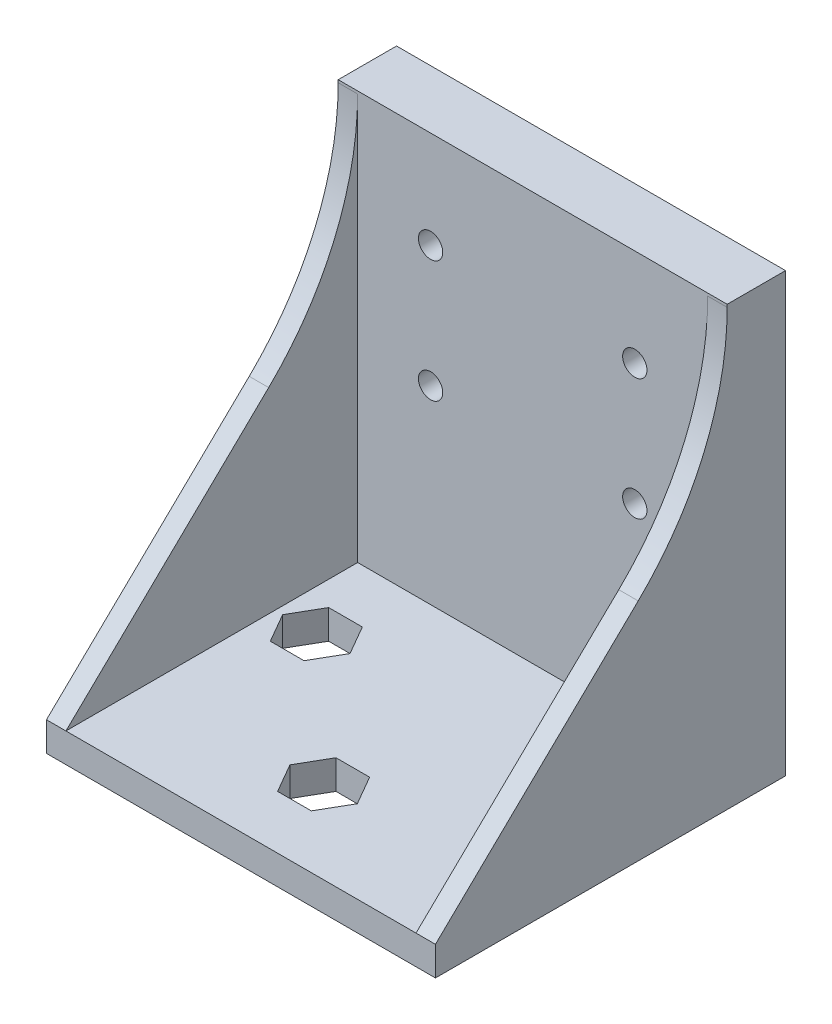
from build123d import *

# Parameters (mm, degrees)
SKETCH1_W             = 40
SKETCH1_H             = 30
BOSS_EXTRUDE1_DEPTH   = 3
CUT_EXTRUDE1_REACH    = 27.179
SKETCH3_W             = 40
SKETCH3_H             = 6
BOSS_EXTRUDE2_DEPTH   = 45
RIB1_REACH            = 65.765
SKETCH5_WALL_W        = 171.255680626
SKETCH5_WALL_H        = 2
RIB2_START            = -2
RIB2_DEPTH            = 2
FILLET1_R             = 30
SKETCH7_W             = 30
SKETCH7_H             = 35
SKETCH7_R             = 2.25
CUT_EXTRUDE2_DEPTH    = 2.5
F_2_5MM_DOWEL_HOLE1_D = 2.5


# Read off the part's stored shape, not the designer's step: Rib2
with BuildPart() as part:
    # Sketch1 → Boss-Extrude1 (new body)
    with BuildSketch(Plane(origin=(0, 0, 0), x_dir=(1, 0, 0), z_dir=(0, 1, 0))):
        Rectangle(SKETCH1_W, SKETCH1_H)
    extrude(amount=BOSS_EXTRUDE1_DEPTH)

    # Sketch2 → Cut-Extrude1 (cut, up to next)
    with BuildSketch(Plane(origin=(0, 3, 0), x_dir=(1, 0, 0), z_dir=(0, 1, 0)), mode=Mode.PRIVATE) as cut_extrude1_sk1:
        Polygon((-10.285898385, 6.5), (-12.017949192, 9.5), (-15.482050808, 9.5), (-17.214101615, 6.5), (-15.482050808, 3.5), (-12.017949192, 3.5), align=None)
    cut_extrude1_tool1 = extrude(cut_extrude1_sk1.sketch, amount=-CUT_EXTRUDE1_REACH, mode=Mode.PRIVATE) & part.part
    # Sketch2 → Cut-Extrude1 (cut, up to next)
    with BuildSketch(Plane(origin=(0, 3, 0), x_dir=(1, 0, 0), z_dir=(0, 1, 0)), mode=Mode.PRIVATE) as cut_extrude1_sk2:
        Polygon((17.214101615, 6.5), (15.482050808, 9.5), (12.017949192, 9.5), (10.285898385, 6.5), (12.017949192, 3.5), (15.482050808, 3.5), align=None)
    cut_extrude1_tool2 = extrude(cut_extrude1_sk2.sketch, amount=-CUT_EXTRUDE1_REACH, mode=Mode.PRIVATE) & part.part
    # Sketch2 → Cut-Extrude1 (cut, up to next)
    with BuildSketch(Plane(origin=(0, 3, 0), x_dir=(1, 0, 0), z_dir=(0, 1, 0)), mode=Mode.PRIVATE) as cut_extrude1_sk3:
        Polygon((-1.732050808, -9.5), (1.732050808, -9.5), (3.464101615, -6.5), (1.732050808, -3.5), (-1.732050808, -3.5), (-3.464101615, -6.5), align=None)
    cut_extrude1_tool3 = extrude(cut_extrude1_sk3.sketch, amount=-CUT_EXTRUDE1_REACH, mode=Mode.PRIVATE) & part.part
    add(cut_extrude1_tool1.solids().sort_by_distance((-13.75, 3, -6.5))[0], mode=Mode.SUBTRACT)
    add(cut_extrude1_tool2.solids().sort_by_distance((13.75, 3, -6.5))[0], mode=Mode.SUBTRACT)
    add(cut_extrude1_tool3.solids().sort_by_distance((0, 3, 6.5))[0], mode=Mode.SUBTRACT)

    # Sketch3 → Boss-Extrude2 (add)
    with BuildSketch(Plane.XZ):
        with Locations((0, -18)):
            Rectangle(SKETCH3_W, SKETCH3_H)
    extrude(amount=-BOSS_EXTRUDE2_DEPTH)

    # Sketch5 wall → Rib1 (add, up to next)
    with BuildSketch(Plane(origin=(-20, 17.5, 0), x_dir=(0, -0.695022096847, 0.718988376049), z_dir=(0, 0.718988376049, 0.695022096847)), mode=Mode.PRIVATE) as rib1_sk1:
        with Locations((0, 1)):
            Rectangle(SKETCH5_WALL_W, SKETCH5_WALL_H)
    rib1_tool1 = extrude(rib1_sk1.sketch, amount=-RIB1_REACH, mode=Mode.PRIVATE) - part.part
    add(rib1_tool1.solids().sort_by_distance((-20, 17.5, 0))[0])

    # Rib2 outline → Rib2 (add)
    with BuildSketch(Plane(origin=(20, 0, 0), x_dir=(0, 0, -1), z_dir=(1, 0, 0)).offset(RIB2_START)):
        Polygon((15, 32), (-15, 3), (15, 3), align=None)
    extrude(amount=RIB2_DEPTH)

    # Fillet1
    fillet1_edges = [part.edges().sort_by_distance(p)[0] for p in [
        (19, 32, -15),
        (-19, 32, -15),
    ]]
    fillet(fillet1_edges, radius=FILLET1_R)

    # Sketch7 → Cut-Extrude2 (cut)
    with BuildSketch(Plane(origin=(0, 0, -21), x_dir=(-1, 0, 0), z_dir=(0, 0, -1))):
        with Locations((0, 22.5)):
            Rectangle(SKETCH7_W, SKETCH7_H)
        with Locations((-10.5, 35)):
            Circle(SKETCH7_R, mode=Mode.SUBTRACT)
        with Locations((10.5, 35)):
            Circle(SKETCH7_R, mode=Mode.SUBTRACT)
        with Locations((10.5, 22.5)):
            Circle(SKETCH7_R, mode=Mode.SUBTRACT)
        with Locations((-10.5, 22.5)):
            Circle(SKETCH7_R, mode=Mode.SUBTRACT)
    extrude(amount=-CUT_EXTRUDE2_DEPTH, mode=Mode.SUBTRACT)

    # Ø2.5mm Dowel Hole1 (through all)
    with Locations(Plane(origin=(0, 0, -21), x_dir=(-1, 0, 0), z_dir=(0, 0, -1))):
        with Locations((10.5, 35), (-10.5, 35), (-10.5, 22.5), (10.5, 22.5)):
            Hole(F_2_5MM_DOWEL_HOLE1_D / 2)


solid = part.part
